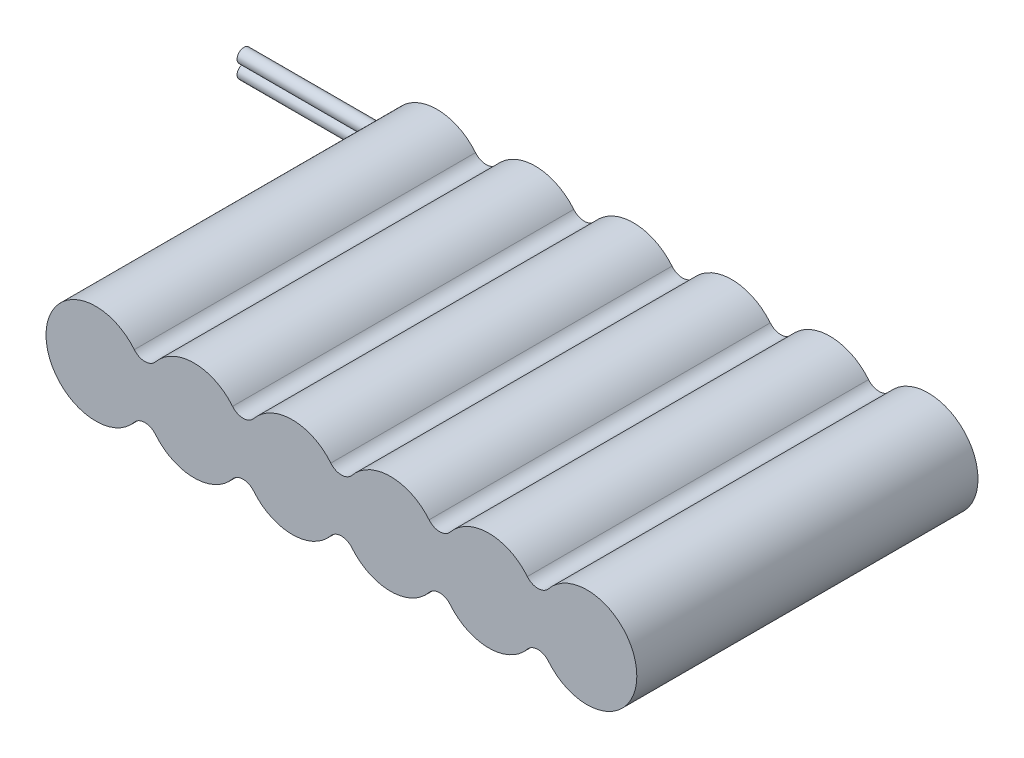
from build123d import *

# Parameters (mm, degrees)
SKETCH1_R           = 9.260416667
BOSS_EXTRUDE4_DEPTH = 63.5
FILLET1_R           = 2.54
BOSS_EXTRUDE5_DEPTH = 25.4


with BuildPart() as part:
    # Sketch1 → Boss-Extrude4 (new body)
    with BuildSketch(Plane.XY):
        Circle(SKETCH1_R)
        with Locations((18.288, 0)):
            Circle(SKETCH1_R)
        with Locations((36.576, 0)):
            Circle(SKETCH1_R)
        with Locations((54.864, 0)):
            Circle(SKETCH1_R)
        with Locations((73.152, 0)):
            Circle(SKETCH1_R)
        with Locations((91.44, 0)):
            Circle(SKETCH1_R)
    extrude(amount=BOSS_EXTRUDE4_DEPTH)

    # Fillet1
    fillet1_edges = [part.edges().sort_by_distance(p)[0] for p in [
        (82.296, -1.463755731, 31.75),
        (64.008, -1.463755731, 31.75),
        (45.72, -1.463755731, 31.75),
        (27.432, -1.463755731, 31.75),
        (9.144, -1.463755731, 31.75),
        (9.144, 1.463755731, 31.75),
        (27.432, 1.463755731, 31.75),
        (45.72, 1.463755731, 31.75),
        (64.008, 1.463755731, 31.75),
        (82.296, 1.463755731, 31.75),
    ]]
    fillet(fillet1_edges, radius=FILLET1_R)


with BuildPart() as body_2:
    # Sketch2 → Boss-Extrude5 (new body)
    with BuildSketch(Plane.ZY.offset(9.260416667)):
        with BuildLine():
            Line((1.120363234, 0.008846227), (1.120363234, -0.008846227))
            ThreePointArc((1.120363234, -0.008846227), (1.27, -2.54), (1.419636766, -0.008846227))
            Line((1.419636766, -0.008846227), (1.419636766, 0.008846227))
            ThreePointArc((1.419636766, 0.008846227), (1.27, 2.54), (1.120363234, 0.008846227))
        make_face()
    extrude(amount=BOSS_EXTRUDE5_DEPTH)


solid = Compound([part.part, body_2.part])
